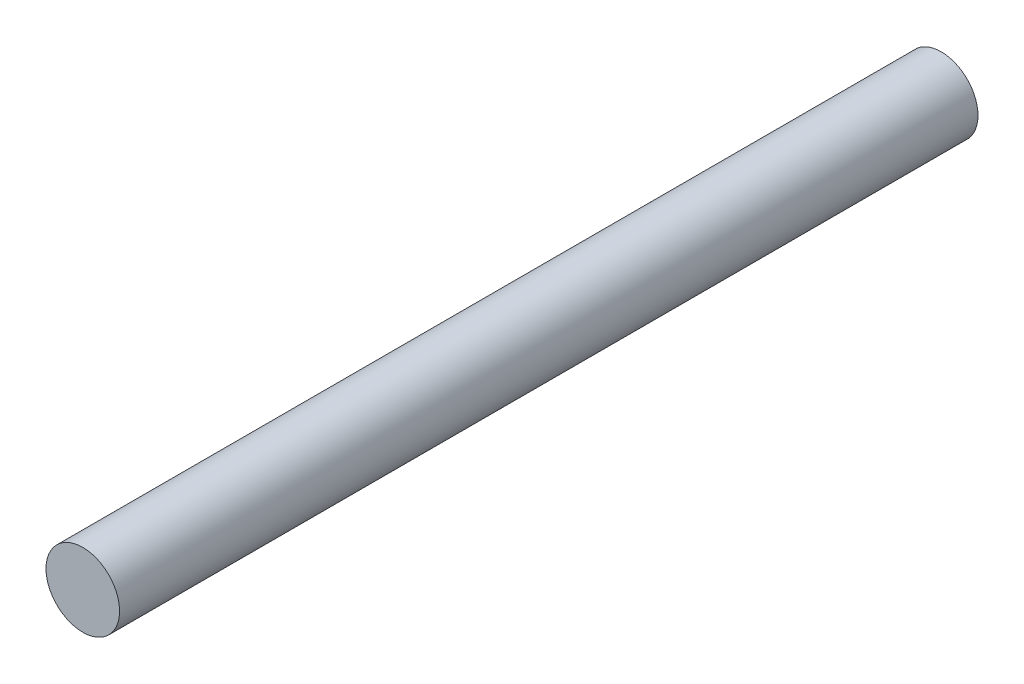
from build123d import *

# Parameters (mm, degrees)
BOSS_EXTRUDE1_OUTLINE_R = 6.35
BOSS_EXTRUDE1_DEPTH     = 148.19884


# Read off the part's stored shape, not the designer's step: Boss-Extrude1
with BuildPart() as part:
    # Boss-Extrude1 outline → Boss-Extrude1 (new body)
    with BuildSketch(Plane.XY.offset(-22.86)):
        with Locations((-36.068, 0)):
            Circle(BOSS_EXTRUDE1_OUTLINE_R)
    extrude(amount=BOSS_EXTRUDE1_DEPTH)


solid = part.part
